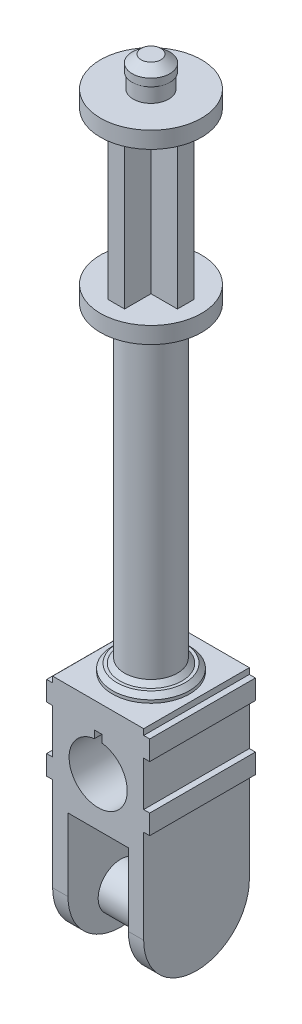
from build123d import *

# Parameters (mm, degrees)
SKETCH2_W               = 6.03
SKETCH2_H               = 7
BOSS_EXTRUDE1_DEPTH     = 15.64
CUT_EXTRUDE1_DEPTH      = 17.307968144
CUT_EXTRUDE1_DEPTH_BACK = 17.307968144
SKETCH3_W               = 4
SKETCH3_H               = 8.3
FILLET1_R               = 3.5
SKETCH4_R               = 1.5
BOSS_EXTRUDE2_DEPTH     = 4
CUT_EXTRUDE2_DEPTH      = 18.398270747
CUT_EXTRUDE2_DEPTH_BACK = 18.398270747
SKETCH7_W               = 7
SKETCH7_H               = 1.3
BOSS_EXTRUDE3_DEPTH     = 0.4
SKETCH8_R               = 1.75
BOSS_EXTRUDE4_DEPTH     = 21.14
SKETCH9_R               = 3.35
BOSS_EXTRUDE5_DEPTH     = 1.1
BOSS_EXTRUDE6_DEPTH     = 10.1
SKETCH11_R              = 3.35
BOSS_EXTRUDE7_DEPTH     = 1.1
SKETCH12_R              = 1.175
BOSS_EXTRUDE8_DEPTH     = 1
SKETCH13_R              = 1.25
BOSS_EXTRUDE9_DEPTH     = 1
CHAMFER1_SIZE           = 0.5
CHAMFER1_SIZE2          = 0.595876796
SKETCH14_R              = 2.55
BOSS_EXTRUDE10_DEPTH    = 0.5
CHAMFER3_SIZE           = 0.3


with BuildPart() as part:
    # Sketch2 → Boss-Extrude1 (new body)
    with BuildSketch(Plane(origin=(0, 0, 0), x_dir=(1, 0, 0), z_dir=(0, 1, 0))):
        Rectangle(SKETCH2_W, SKETCH2_H)
    extrude(amount=BOSS_EXTRUDE1_DEPTH)

    # Sketch3 → Cut-Extrude1 (cut, two sides: drawn at the far end of the back side and taken through both)
    with BuildSketch(Plane.XY.offset(-CUT_EXTRUDE1_DEPTH_BACK)):
        with Locations((0, 4.15)):
            Rectangle(SKETCH3_W, SKETCH3_H)
    extrude(amount=CUT_EXTRUDE1_DEPTH + CUT_EXTRUDE1_DEPTH_BACK, mode=Mode.SUBTRACT)

    # Fillet1
    fillet1_edges = [part.edges().sort_by_distance(p)[0] for p in [
        (-2.5075, 0, 3.5),
        (-2.5075, 0, -3.5),
        (2.5075, 0, -3.5),
        (2.5075, 0, 3.5),
    ]]
    fillet(fillet1_edges, radius=FILLET1_R - 0.0001)  # a hair under: the kernel refuses the full size

    # Sketch4 → Boss-Extrude2 (add)
    with BuildSketch(Plane(origin=(-2, 0, 0), x_dir=(0, 0, -1), z_dir=(1, 0, 0))):
        with Locations(Location((0, 2.4, 0), (0, 0, 180))):
            Circle(SKETCH4_R)
    extrude(amount=BOSS_EXTRUDE2_DEPTH)

    # Sketch6 → Cut-Extrude2 (cut, two sides: drawn at the far end of the back side and taken through both)
    with BuildSketch(Plane(origin=(0, 0, -3.5), x_dir=(-1, 0, 0), z_dir=(0, 0, -1)).offset(-CUT_EXTRUDE2_DEPTH_BACK)):
        with BuildLine():
            Line((-0.25, 13.4336972), (-0.25, 13.9336972))
            Line((-0.25, 13.9336972), (0.25, 13.9336972))
            Line((0.25, 13.9336972), (0.25, 13.4336972))
            ThreePointArc((0.25, 13.4336972), (0, 9.6), (-0.25, 13.4336972))
        make_face()
    extrude(amount=CUT_EXTRUDE2_DEPTH + CUT_EXTRUDE2_DEPTH_BACK, mode=Mode.SUBTRACT)

    # Sketch7 → Boss-Extrude3 (add)
    with BuildSketch(Plane(origin=(3.015, 0, 0), x_dir=(0, 0, -1), z_dir=(1, 0, 0))):
        with Locations((0, 14.6)):
            Rectangle(SKETCH7_W, SKETCH7_H)
        with Locations((0, 10.35)):
            Rectangle(SKETCH7_W, SKETCH7_H)
    boss_extrude3 = extrude(amount=BOSS_EXTRUDE3_DEPTH)

    # Mirror1: Boss-Extrude3 across plane
    add(boss_extrude3.mirror(Plane(origin=(0, 0, 0), x_dir=(0, 0, 1), z_dir=(1, 0, 0))))

    # Sketch8 → Boss-Extrude4 (add)
    with BuildSketch(Plane(origin=(0, 15.64, 0), x_dir=(1, 0, 0), z_dir=(0, 1, 0))):
        with Locations(Location((0, 0, 0), (0, 0, 270))):
            Circle(SKETCH8_R)
    extrude(amount=BOSS_EXTRUDE4_DEPTH)

    # Sketch9 → Boss-Extrude5 (add)
    with BuildSketch(Plane(origin=(0, 36.78, 0), x_dir=(1, 0, 0), z_dir=(0, 1, 0))):
        with Locations(Location((0, 0, 0), (0, 0, 270))):
            Circle(SKETCH9_R)
    extrude(amount=BOSS_EXTRUDE5_DEPTH)

    # Sketch10 → Boss-Extrude6 (add)
    with BuildSketch(Plane(origin=(0, 37.88, 0), x_dir=(1, 0, 0), z_dir=(0, 1, 0))):
        Polygon((-0.55, 2.3), (-0.55, 0.55), (-2.3, 0.55), (-2.3, -0.55), (-0.55, -0.55), (-0.55, -2.3), (0.55, -2.3), (0.55, -0.55), (2.3, -0.55), (2.3, 0.55), (0.55, 0.55), (0.55, 2.3), align=None)
    extrude(amount=BOSS_EXTRUDE6_DEPTH)

    # Sketch11 → Boss-Extrude7 (add)
    with BuildSketch(Plane(origin=(0, 47.98, 0), x_dir=(1, 0, 0), z_dir=(0, 1, 0))):
        with Locations(Location((0, 0, 0), (0, 0, 270))):
            Circle(SKETCH11_R)
    extrude(amount=BOSS_EXTRUDE7_DEPTH)

    # Sketch12 → Boss-Extrude8 (add)
    with BuildSketch(Plane(origin=(0, 49.08, 0), x_dir=(1, 0, 0), z_dir=(0, 1, 0))):
        with Locations(Location((0, 0, 0), (0, 0, 270))):
            Circle(SKETCH12_R)
    extrude(amount=BOSS_EXTRUDE8_DEPTH)

    # Sketch13 → Boss-Extrude9 (add)
    with BuildSketch(Plane(origin=(0, 50.08, 0), x_dir=(1, 0, 0), z_dir=(0, 1, 0))):
        with Locations(Location((0, 0, 0), (0, 0, 270))):
            Circle(SKETCH13_R)
    extrude(amount=BOSS_EXTRUDE9_DEPTH)

    # Chamfer1
    chamfer1_edges = [part.edges().sort_by_distance(p)[0] for p in [
        (0, 51.08, -1.25),
    ]]
    chamfer1_side = [part.faces().sort_by_distance(p)[0] for p in [
        (0, 50.58, -1.25),
    ]]
    chamfer(chamfer1_edges, length=CHAMFER1_SIZE, length2=CHAMFER1_SIZE2, reference=chamfer1_side[0])

    # Sketch14 → Boss-Extrude10 (add)
    with BuildSketch(Plane(origin=(0, 15.64, 0), x_dir=(1, 0, 0), z_dir=(0, 1, 0))):
        with Locations(Location((0, 0, 0), (0, 0, 90))):
            Circle(SKETCH14_R)
    extrude(amount=BOSS_EXTRUDE10_DEPTH)

    # Chamfer3
    chamfer3_edges = [part.edges().sort_by_distance(p)[0] for p in [
        (0, 16.14, -1.75),
        (0, 16.14, 2.55),
    ]]
    chamfer(chamfer3_edges, length=CHAMFER3_SIZE)


solid = part.part
